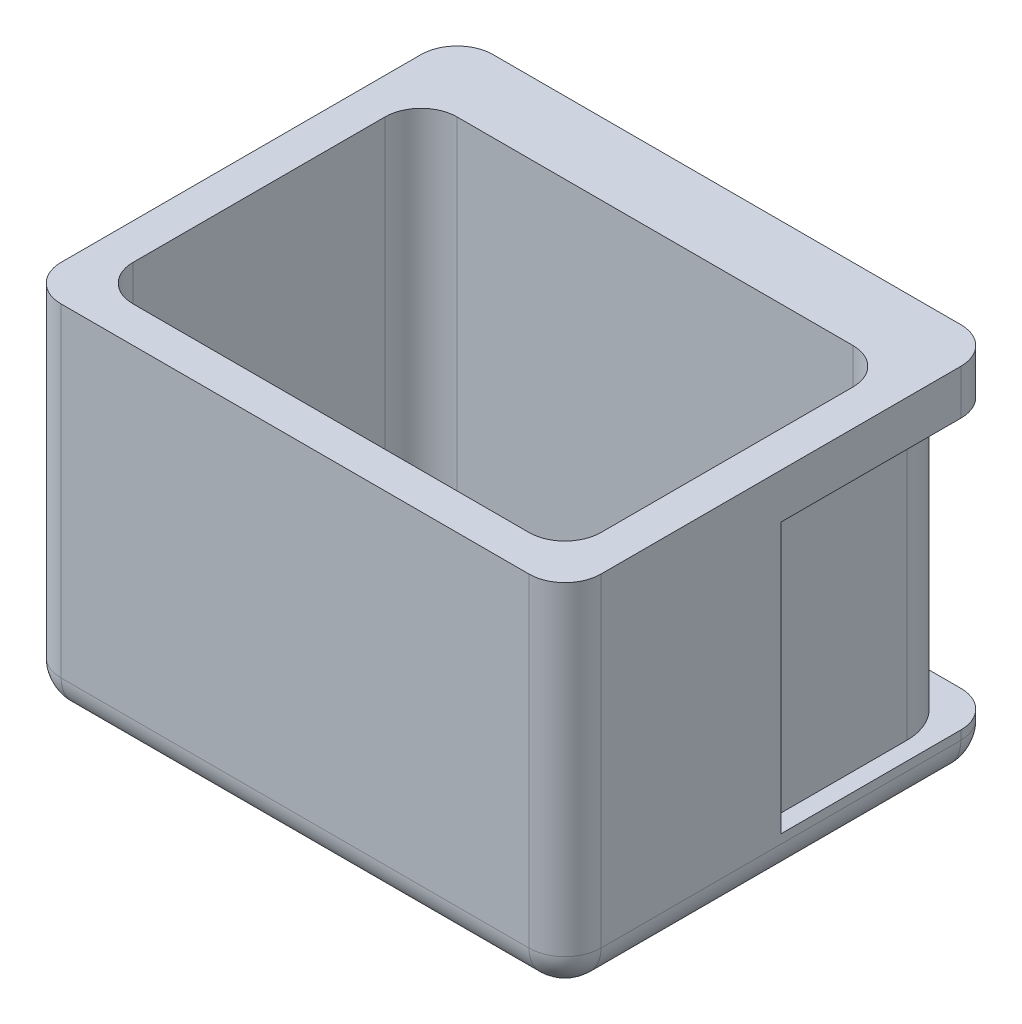
from build123d import *

# Parameters (mm, degrees)
SKETCH1_W           = 150
SKETCH1_H           = 120
BOSS_EXTRUDE1_DEPTH = 100
FILLET1_R           = 10
SHELL1_START        = -65
SHELL1_OUTLINE_W    = 90
SHELL1_OUTLINE_H    = 100
SHELL1_DEPTH        = 130
FILLET2_R           = 10
CUT_EXTRUDE1_DEPTH  = 37.5
BOSS_EXTRUDE2_START = 90
BOSS_EXTRUDE2_DEPTH = 90
SKETCH3_W           = 114.3
SKETCH3_H           = 50.8
CUT_EXTRUDE2_DEPTH  = 5.5
FILLET3_R           = 10


# Read off the part's stored shape, not the designer's step: Shell1
with BuildPart() as part:
    # Sketch1 → Boss-Extrude1 (new body)
    with BuildSketch(Plane(origin=(0, 0, 0), x_dir=(1, 0, 0), z_dir=(0, 1, 0))):
        Rectangle(SKETCH1_W, SKETCH1_H)
    extrude(amount=BOSS_EXTRUDE1_DEPTH)

    # Fillet1
    fillet1_edges = [part.edges().sort_by_distance(p)[0] for p in [
        (0, 0, 60),
        (-75, 0, 0),
        (0, 0, -60),
        (75, 0, 0),
        (75, 50, 60),
        (-75, 50, 60),
        (-75, 50, -60),
        (75, 50, -60),
    ]]
    fillet(fillet1_edges, radius=FILLET1_R)

    # Shell1 outline → Shell1 (cut)
    with BuildSketch(Plane.YZ.offset(SHELL1_START)):
        with Locations((55, 0)):
            Rectangle(SHELL1_OUTLINE_W, SHELL1_OUTLINE_H)
    extrude(amount=SHELL1_DEPTH, mode=Mode.SUBTRACT)

    # Fillet2
    fillet2_edges = [part.edges().sort_by_distance(p)[0] for p in [
        (65, 55, -50),
        (-65, 55, -50),
        (-65, 55, 50),
        (65, 55, 50),
    ]]
    fillet(fillet2_edges, radius=FILLET2_R)

    # Sketch2 → Cut-Extrude1 (cut, symmetric)
    with BuildSketch(Plane(origin=(0, 50, 0), x_dir=(1, 0, 0), z_dir=(0, 1, 0))):
        with BuildLine():
            Line((-75, 50), (-75, 0))
            Line((-75, 0), (-70, 0))
            Line((-70, 0), (-70, 40))
            ThreePointArc((-70, 40), (-65.606601718, 50.606601718), (-55, 55))
            Line((-55, 55), (55, 55))
            ThreePointArc((55, 55), (65.606601718, 50.606601718), (70, 40))
            Line((70, 40), (70, 0))
            Line((70, 0), (75, 0))
            Line((75, 0), (75, 50))
            ThreePointArc((75, 50), (72.071067812, 57.071067812), (65, 60))
            Line((65, 60), (-65, 60))
            ThreePointArc((-65, 60), (-72.071067812, 57.071067812), (-75, 50))
        make_face()
    extrude(amount=CUT_EXTRUDE1_DEPTH, both=True, mode=Mode.SUBTRACT)

    # Sketch4 → Boss-Extrude2 (add)
    with BuildSketch(Plane(origin=(0, 10, 0), x_dir=(1, 0, 0), z_dir=(0, 1, 0)).offset(BOSS_EXTRUDE2_START)):
        with BuildLine():
            Line((-65, 40), (65, 40))
            ThreePointArc((65, 40), (62.071067812, 47.071067812), (55, 50))
            Line((55, 50), (-55, 50))
            ThreePointArc((-55, 50), (-62.071067812, 47.071067812), (-65, 40))
        make_face()
    extrude(amount=-BOSS_EXTRUDE2_DEPTH)

    # Sketch3 → Cut-Extrude2 (cut, symmetric)
    with BuildSketch(Plane(origin=(0, 0, -55), x_dir=(-1, 0, 0), z_dir=(0, 0, -1))):
        with Locations((0, 62.1)):
            Rectangle(SKETCH3_W, SKETCH3_H)
    extrude(amount=CUT_EXTRUDE2_DEPTH, both=True, mode=Mode.SUBTRACT)

    # Fillet3
    fillet3_edges = [part.edges().sort_by_distance(p)[0] for p in [
        (-65, 55, -40),
        (65, 55, -40),
    ]]
    fillet(fillet3_edges, radius=FILLET3_R)


solid = part.part
